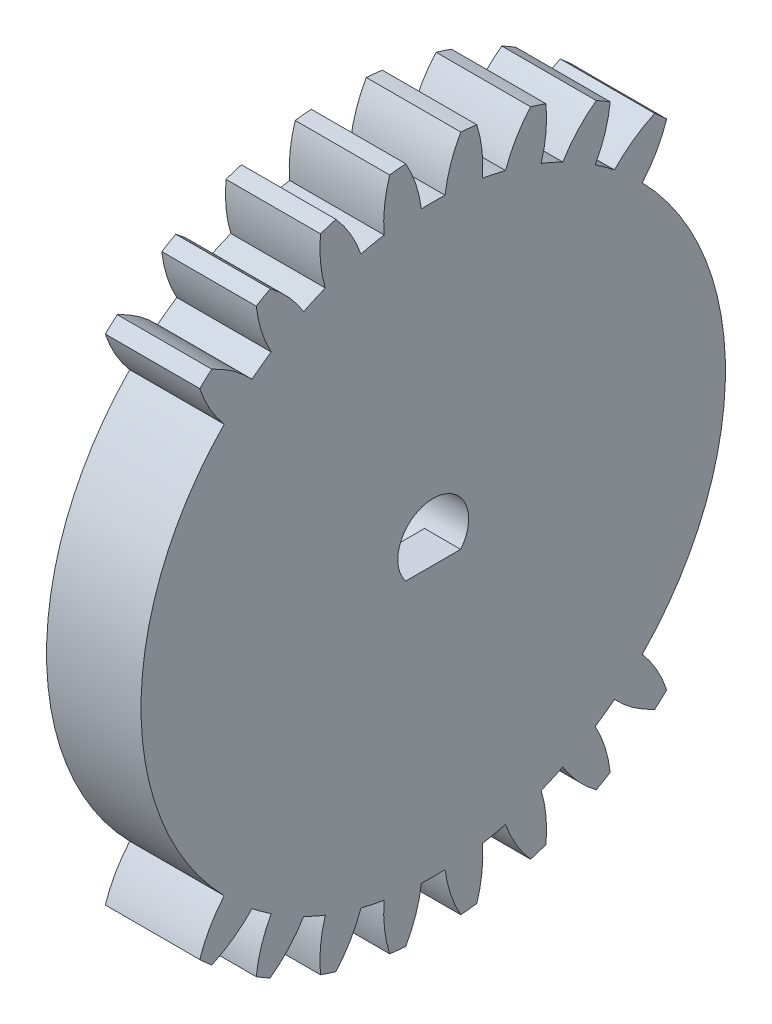
from build123d import *

# Parameters (mm, degrees)
BASPROSKE_W        = 4
BASPROSKE_H        = 14.4
TOOTHCUT_DEPTH     = 21.753794834
TEETHCUTS_COUNT    = 30
TEETHCUTS_ANGLE    = 348
BORE_DEPTH         = 50.0000508
CUT_EXTRUDE2_START = -10
CUT_EXTRUDE2_DEPTH = 10
CUT_EXTRUDE3_START = -2.47
SKETCH3_R          = 1.5
CUT_EXTRUDE3_DEPTH = 2.47


with BuildPart() as part:
    # BasProSke → Base-Revolve (revolve)
    with BuildSketch(Plane(origin=(0, 0, 0), x_dir=(1, 0, 0), z_dir=(0, 1, 0))):
        with Locations((2, 7.2)):
            Rectangle(BASPROSKE_W, BASPROSKE_H)
    revolve(axis=Axis((-10, 0, 0), (1, 0, 0)))

    # TooCutSke → ToothCut (cut, through all)
    with BuildSketch(Plane(origin=(0, 0, 0), x_dir=(0, 0, -1), z_dir=(1, 0, 0))):
        with BuildLine():
            ThreePointArc((0.502005058, 12.363812799), (0, 12.374), (-0.502005058, 12.363812799))
            ThreePointArc((-0.502005058, 12.363812799), (-0.740487606, 13.404090158), (-1.178907792, 14.377146503))
            ThreePointArc((-1.178907792, 14.377146503), (0, 14.4254), (1.178907792, 14.377146503))
            ThreePointArc((1.178907792, 14.377146503), (0.740487606, 13.404090158), (0.502005058, 12.363812799))
        make_face()
    toothcut = extrude(amount=TOOTHCUT_DEPTH, mode=Mode.SUBTRACT)

    # TeethCuts: ToothCut ×30 about axis
    teethcuts_axis = Axis((-10, 0, 0), (1, 0, 0))
    for i in range(1, TEETHCUTS_COUNT):
        add(toothcut.rotate(teethcuts_axis, i * TEETHCUTS_ANGLE / (TEETHCUTS_COUNT - 1)), mode=Mode.SUBTRACT)

    # BorSke → Bore (cut, symmetric)
    with BuildSketch(Plane(origin=(0, 0, 0), x_dir=(0, 0, -1), z_dir=(1, 0, 0))):
        with BuildLine():
            Line((-1.160818677, -0.95), (1.160818677, -0.95))
            ThreePointArc((1.160818677, -0.95), (0, 1.5), (-1.160818677, -0.95))
        make_face()
    extrude(amount=BORE_DEPTH, both=True, mode=Mode.SUBTRACT)

    # Sketch1 → Cut-Extrude2 (cut)
    with BuildSketch(Plane(origin=(4, 0, 0), x_dir=(0, 0, -1), z_dir=(1, 0, 0)).offset(CUT_EXTRUDE2_START)):
        with BuildLine():
            Line((-9.19567407, 8.279822123), (-11.837430087, 9.990379384))
            ThreePointArc((-11.837430087, 9.990379384), (-15.480248321, -0.542534064), (-11.108982601, -10.79457905))
            Line((-11.108982601, -10.79457905), (-9.083189008, -8.403068097))
            ThreePointArc((-9.083189008, -8.403068097), (-12.373718737, -0.083430299), (-9.19567407, 8.279822123))
        make_face()
        with BuildLine():
            Line((9.083189008, -8.403068097), (11.108982601, -10.79457905))
            ThreePointArc((11.108982601, -10.79457905), (15.480248321, -0.542534064), (11.837430087, 9.990379384))
            Line((11.837430087, 9.990379384), (9.19567407, 8.279822123))
            ThreePointArc((9.19567407, 8.279822123), (12.373718737, -0.083430299), (9.083189008, -8.403068097))
        make_face()
    extrude(amount=CUT_EXTRUDE2_DEPTH, mode=Mode.SUBTRACT)

    # Sketch3 → Cut-Extrude3 (cut)
    with BuildSketch(Plane.ZY.offset(CUT_EXTRUDE3_START)):
        Circle(SKETCH3_R)
    extrude(amount=CUT_EXTRUDE3_DEPTH, mode=Mode.SUBTRACT)


solid = part.part
